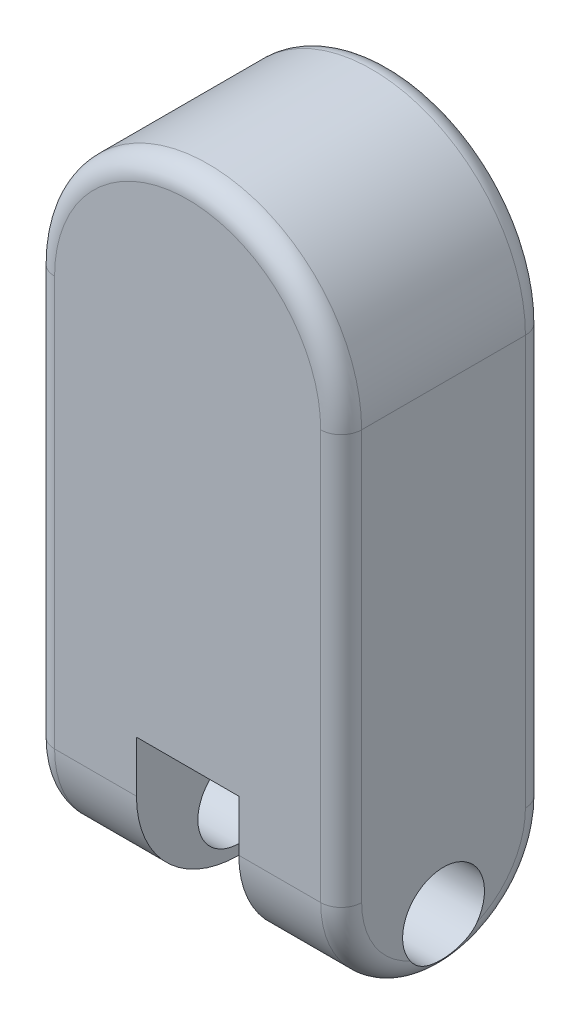
from build123d import *

# Parameters (mm, degrees)
BOSS_EXTRUDE1_DEPTH    = 100
SKETCH2_W              = 50
SKETCH2_H              = 50
CUT_EXTRUDE1_DEPTH     = 177.776695297
CUT_EXTRUDE2_DEPTH     = 25
SKETCH7_R              = 20
CUT_EXTRUDE3_DEPTH     = 220.374109685
FILLET2_R              = 50
CUT_EXTRUDE6_START     = -125
CUT_EXTRUDE6_OUTLINE_W = 50
CUT_EXTRUDE6_OUTLINE_H = 6.698729811
CUT_EXTRUDE6_DEPTH     = 50
CUT_EXTRUDE7_DEPTH     = 25
BOSS_EXTRUDE2_DEPTH    = 100
FILLET4_R              = 10
SKETCH11_W             = 50
SKETCH11_H             = 25
CUT_EXTRUDE11_DEPTH    = 99
SKETCH16_W             = 50
SKETCH16_H             = 30
BOSS_EXTRUDE3_DEPTH    = 0.1
FILLET5_R              = 10


with BuildPart() as part:
    # Sketch1 → Boss-Extrude1 (new body)
    with BuildSketch(Plane.XY):
        Polygon((-75, 125), (0.2, 125), (49.8, 125), (75, 125), (75, -125), (-75, -125), align=None)
    extrude(amount=-BOSS_EXTRUDE1_DEPTH)

    # Sketch2 → Cut-Extrude1 (cut, through all)
    with BuildSketch(Plane.XY):
        with Locations((0, -125)):
            Rectangle(SKETCH2_W, SKETCH2_H)
    extrude(amount=-CUT_EXTRUDE1_DEPTH, mode=Mode.SUBTRACT)

    # Sketch6 → Cut-Extrude2 (cut, symmetric)
    with BuildSketch(Plane(origin=(0, 0, 0), x_dir=(0, 0, -1), z_dir=(1, 0, 0))):
        with BuildLine():
            Line((100, -100), (0, -100))
            ThreePointArc((0, -100), (50, -50), (100, -100))
        make_face()
    extrude(amount=CUT_EXTRUDE2_DEPTH, both=True, mode=Mode.SUBTRACT)

    # Sketch7 → Cut-Extrude3 (cut, through all)
    with BuildSketch(Plane.ZY.offset(75)):
        with Locations(Location((-50, -100, 0), (0, 0, 270))):
            Circle(SKETCH7_R)
    extrude(amount=-CUT_EXTRUDE3_DEPTH, mode=Mode.SUBTRACT)

    # Fillet2
    fillet2_edges = [part.edges().sort_by_distance(p)[0] for p in [
        (-50, -125, -100),
        (-50, -125, 0),
    ]]
    fillet(fillet2_edges, radius=FILLET2_R - 0.0001)  # a hair under: the kernel refuses the full size

    # Cut-Extrude6: read off the stored shape, not the designer's step
    # Cut-Extrude6 outline → Cut-Extrude6 (cut)
    with BuildSketch(Plane(origin=(0, 0, 0), x_dir=(1, 0, 0), z_dir=(0, 1, 0)).offset(CUT_EXTRUDE6_START)):
        with Locations((0, 96.650635095)):
            Rectangle(CUT_EXTRUDE6_OUTLINE_W, CUT_EXTRUDE6_OUTLINE_H)
        with Locations((0, 3.349364906)):
            Rectangle(CUT_EXTRUDE6_OUTLINE_W, CUT_EXTRUDE6_OUTLINE_H)
    extrude(amount=CUT_EXTRUDE6_DEPTH, mode=Mode.SUBTRACT)

    # Sketch10 → Cut-Extrude7 (cut, symmetric)
    with BuildSketch(Plane(origin=(0, 0, 0), x_dir=(0, 0, -1), z_dir=(1, 0, 0))):
        with BuildLine():
            Line((0, -75), (100, -75))
            ThreePointArc((100, -75), (50, -61.602540378), (0, -75))
        make_face()
    extrude(amount=CUT_EXTRUDE7_DEPTH, both=True, mode=Mode.SUBTRACT)

    # Sketch15 → Boss-Extrude2 (add)
    with BuildSketch(Plane.XY):
        with BuildLine():
            Line((-75, 125), (75, 125))
            ThreePointArc((75, 125), (0, 200), (-75, 125))
        make_face()
    extrude(amount=-BOSS_EXTRUDE2_DEPTH)

    # Fillet4
    # the kernel refuses this fillet: 10 mm, written as the material it takes off along each edge
    with BuildSketch(Plane(origin=(0, 125, -100), x_dir=(1, 0, 0), z_dir=(0, -1, 0))) as fillet4_piece_1:
        with BuildLine():
            CenterArc((75 - FILLET4_R, FILLET4_R), FILLET4_R, 270, 90)
            Line((75, FILLET4_R), (75, 0))
            Line((75, 0), (75 - FILLET4_R, 0))
        make_face()
    revolve(axis=Axis((0, 125, -100), (0, 0, 1)), revolution_arc=180, mode=Mode.SUBTRACT)
    with BuildSketch(Plane(origin=(0, 125, 0), x_dir=(1, 0, 0), z_dir=(0, -1, 0))) as fillet4_piece_2:
        with BuildLine():
            CenterArc((75 - FILLET4_R, -FILLET4_R), FILLET4_R, 0, 90)
            Line((75, -FILLET4_R), (75, 0))
            Line((75, 0), (75 - FILLET4_R, 0))
        make_face()
    revolve(axis=Axis((0, 125, 0), (0, 0, 1)), revolution_arc=180, mode=Mode.SUBTRACT)
    with BuildSketch(Plane(origin=(-75, -75.0001, -100), x_dir=(0, 0, 1), z_dir=(0, 1, 0)), Plane(origin=(75, 125, 0), x_dir=(-1, 0, 0), z_dir=(0, -1, 0))) as fillet4_piece_3:
        with BuildLine():
            CenterArc((FILLET4_R, FILLET4_R), FILLET4_R, 180, 90)
            Line((0, FILLET4_R), (0, 0))
            Line((0, 0), (FILLET4_R, 0))
        make_face()
    extrude(amount=200.0001, mode=Mode.SUBTRACT)
    with BuildSketch(Plane(origin=(75, 125, -100), x_dir=(-1, 0, 0), z_dir=(0, -1, 0)), Plane(origin=(-75, -75.0001, 0), x_dir=(0, 0, -1), z_dir=(0, 1, 0))) as fillet4_piece_4:
        with BuildLine():
            CenterArc((FILLET4_R, -FILLET4_R), FILLET4_R, 90, 90)
            Line((0, -FILLET4_R), (0, 0))
            Line((0, 0), (FILLET4_R, 0))
        make_face()
    extrude(amount=200.0001, mode=Mode.SUBTRACT)
    with BuildSketch(Plane(origin=(75, -75.0001, -49.9999), x_dir=(0, 0, 1), z_dir=(0, 1, 0))) as fillet4_piece_5:
        with BuildLine():
            CenterArc((49.9999 - FILLET4_R, -FILLET4_R), FILLET4_R, 0, 90)
            Line((49.9999 - FILLET4_R, 0), (49.9999, 0))
            Line((49.9999, 0), (49.9999, -FILLET4_R))
        make_face()
    revolve(axis=Axis((75, -75.0001, -49.9999), (1, 0, 0)), revolution_arc=90, mode=Mode.SUBTRACT)
    with BuildSketch(Plane(origin=(75, -75.0001, -50.0001), x_dir=(0, 0, -1), z_dir=(0, 1, 0))) as fillet4_piece_6:
        with BuildLine():
            CenterArc((49.9999 - FILLET4_R, FILLET4_R), FILLET4_R, 270, 90)
            Line((49.9999, FILLET4_R), (49.9999, 0))
            Line((49.9999, 0), (49.9999 - FILLET4_R, 0))
        make_face()
    revolve(axis=Axis((75, -75.0001, -50.0001), (-1, 0, 0)), revolution_arc=90, mode=Mode.SUBTRACT)
    with BuildSketch(Plane(origin=(-75, -75.0001, -49.9999), x_dir=(0, 0, 1), z_dir=(0, 1, 0))) as fillet4_piece_7:
        with BuildLine():
            CenterArc((49.9999 - FILLET4_R, FILLET4_R), FILLET4_R, 270, 90)
            Line((49.9999, FILLET4_R), (49.9999, 0))
            Line((49.9999, 0), (49.9999 - FILLET4_R, 0))
        make_face()
    revolve(axis=Axis((-75, -75.0001, -49.9999), (1, 0, 0)), revolution_arc=90, mode=Mode.SUBTRACT)
    with BuildSketch(Plane(origin=(-75, -75.0001, -50.0001), x_dir=(0, 0, -1), z_dir=(0, 1, 0))) as fillet4_piece_8:
        with BuildLine():
            CenterArc((49.9999 - FILLET4_R, -FILLET4_R), FILLET4_R, 0, 90)
            Line((49.9999, -FILLET4_R), (49.9999, 0))
            Line((49.9999, 0), (49.9999 - FILLET4_R, 0))
        make_face()
    revolve(axis=Axis((-75, -75.0001, -50.0001), (-1, 0, 0)), revolution_arc=90, mode=Mode.SUBTRACT)
    with BuildSketch(Plane(origin=(-75, -125, -49.9999), x_dir=(0, 1, 0), z_dir=(0, 0, -1))) as fillet4_piece_9:
        with BuildLine():
            CenterArc((FILLET4_R, FILLET4_R), FILLET4_R, 180, 90)
            Line((0, FILLET4_R), (0, 0))
            Line((0, 0), (FILLET4_R, 0))
        make_face()
    extrude(amount=0.0002, mode=Mode.SUBTRACT)
    with BuildSketch(Plane(origin=(75, -125, -49.9999), x_dir=(0, 1, 0), z_dir=(0, 0, -1))) as fillet4_piece_10:
        with BuildLine():
            CenterArc((FILLET4_R, -FILLET4_R), FILLET4_R, 90, 90)
            Line((0, -FILLET4_R), (0, 0))
            Line((0, 0), (FILLET4_R, 0))
        make_face()
    extrude(amount=0.0002, mode=Mode.SUBTRACT)

    # Sketch11 → Cut-Extrude11 (cut)
    with BuildSketch(Plane.XY):
        with Locations((0, -62.5)):
            Rectangle(SKETCH11_W, SKETCH11_H)
    extrude(amount=-CUT_EXTRUDE11_DEPTH, mode=Mode.SUBTRACT)


with BuildPart() as body_2:
    # Sketch16 → Boss-Extrude3 (new body)
    with BuildSketch(Plane(origin=(0, 0, -100), x_dir=(-1, 0, 0), z_dir=(0, 0, -1))):
        with Locations((0, -90)):
            Rectangle(SKETCH16_W, SKETCH16_H)
    extrude(amount=BOSS_EXTRUDE3_DEPTH)

    # Fillet5
    # the kernel refuses this fillet: 10 mm, written as the material it takes off along each edge
    with BuildSketch(Plane(origin=(25, -71.473316005, -100.1), x_dir=(0, 0, 1), z_dir=(0, -1, 0)), Plane(origin=(-25, -108.526683995, -100.1), x_dir=(0, 0, 1), z_dir=(0, 1, 0))) as fillet5_piece_1:
        with BuildLine():
            CenterArc((10, 1.410673598), FILLET5_R, 180, 8.109614456)
            Line((0, 1.410673598), (0, 0))
            Line((0, 0), (0.1, 0))
        make_face()
    extrude(amount=37.05336799, mode=Mode.SUBTRACT)
    with BuildSketch(Plane(origin=(28.526683995, -105, -100.1), x_dir=(0, 0, 1), z_dir=(-1, 0, 0))) as fillet5_piece_2:
        with BuildLine():
            CenterArc((10, 1.410673598), FILLET5_R, 180, 8.109614456)
            Line((0, 1.410673598), (0, 0))
            Line((0, 0), (0.1, 0))
        make_face()
    extrude(amount=57.05336799, mode=Mode.SUBTRACT)


solid = Compound([part.part, body_2.part])
